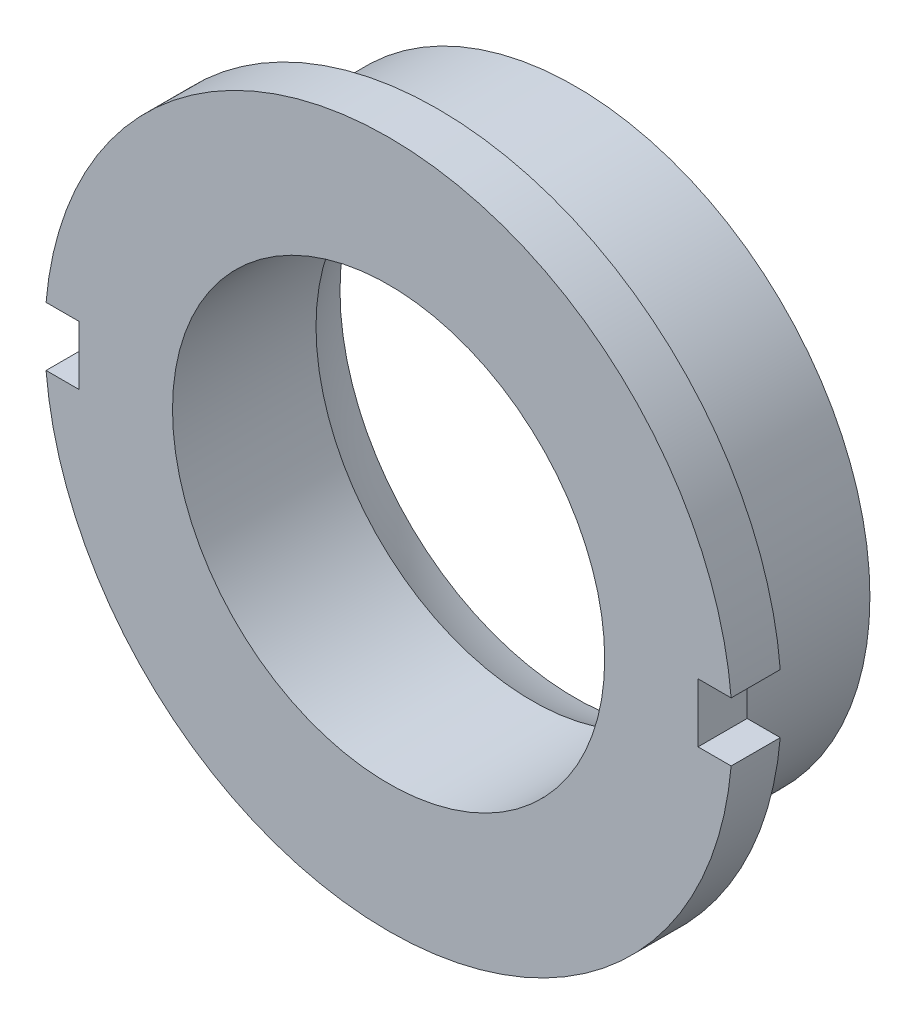
from build123d import *

# Parameters (mm, degrees)
M6X0P35_MALE_THREAD_MAJOR_ENVELOPE_START = 0.8
SKETCH1_R                                = 3
SKETCH1_R_2                              = 2.2
M6X0P35_MALE_THREAD_MAJOR_ENVELOPE_DEPTH = 1.4
BALL_RETENTION_CAP_FLANGE_START          = 2.2
SKETCH2_R                                = 3.5
SKETCH2_R_2                              = 2.2
BALL_RETENTION_CAP_FLANGE_DEPTH          = 0.5
SKETCH3_W                                = 0.45
SKETCH3_H                                = 0.6
OPPOSED_PIN_TOOL_NOTCHES_DEPTH           = 0.5


# Read off the part's stored shape, not the designer's step: Upper_Spherical_Bearing_Seat_D5p05
with BuildPart() as part:
    # Sketch1 → M6x0p35_Male_Thread_Major_Envelope (new body)
    with BuildSketch(Plane.XY.offset(M6X0P35_MALE_THREAD_MAJOR_ENVELOPE_START)):
        Circle(SKETCH1_R)
        Circle(SKETCH1_R_2, mode=Mode.SUBTRACT)
    extrude(amount=M6X0P35_MALE_THREAD_MAJOR_ENVELOPE_DEPTH)

    # Sketch2 → Ball_Retention_Cap_Flange (add)
    with BuildSketch(Plane.XY.offset(BALL_RETENTION_CAP_FLANGE_START)):
        Circle(SKETCH2_R)
        Circle(SKETCH2_R_2, mode=Mode.SUBTRACT)
    extrude(amount=BALL_RETENTION_CAP_FLANGE_DEPTH)

    # Upper_Spherical_Bearing_Seat_D5p05 outli → Upper_Spherical_Bearing_Seat_D5p05 (revolve, cut)
    with BuildSketch(Plane.XZ):
        with BuildLine():
            Line((2.199999999, 0.799999998), (2.394916492, 0.799999998))
            ThreePointArc((2.394916492, 0.799999998), (2.307929655, 1.024248851), (2.199999999, 1.239203375))
            Line((2.199999999, 1.239203375), (2.199999999, 0.799999998))
        make_face()
    revolve(axis=Axis((0, 0, 0), (0, 0, 1)), mode=Mode.SUBTRACT)

    # Sketch3 → Opposed_Pin_Tool_Notches (cut)
    with BuildSketch(Plane.XY.offset(2.7)):
        with Locations((-3.375, 0)):
            Rectangle(SKETCH3_W, SKETCH3_H)
        with Locations((3.375, 0)):
            Rectangle(SKETCH3_W, SKETCH3_H)
    extrude(amount=-OPPOSED_PIN_TOOL_NOTCHES_DEPTH, mode=Mode.SUBTRACT)


solid = part.part
